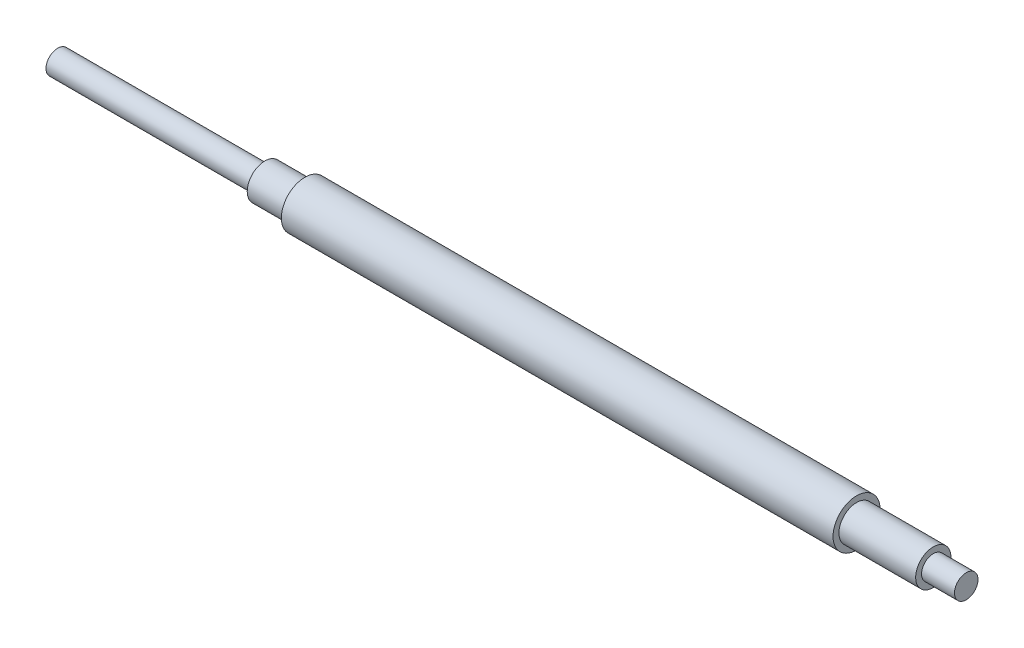
from build123d import *


with BuildPart() as part:
    # Sketch1 → Revolve1 (revolve)
    with BuildSketch(Plane.XY):
        Polygon((-12.976553455, 3.175), (-12.976553455, 0), (-258.086553455, 0), (-258.086553455, 3.175), (-202.206553455, 3.175), (-202.206553455, 4.7625), (-191.411553455, 4.7625), (-191.411553455, 6.35), (-42.567553455, 6.35), (-42.567553455, 4.7625), (-21.866553455, 4.7625), (-21.866553455, 3.175), align=None)
    revolve(axis=Axis((-258.086553455, 0, 0), (1, 0, 0)))


solid = part.part
